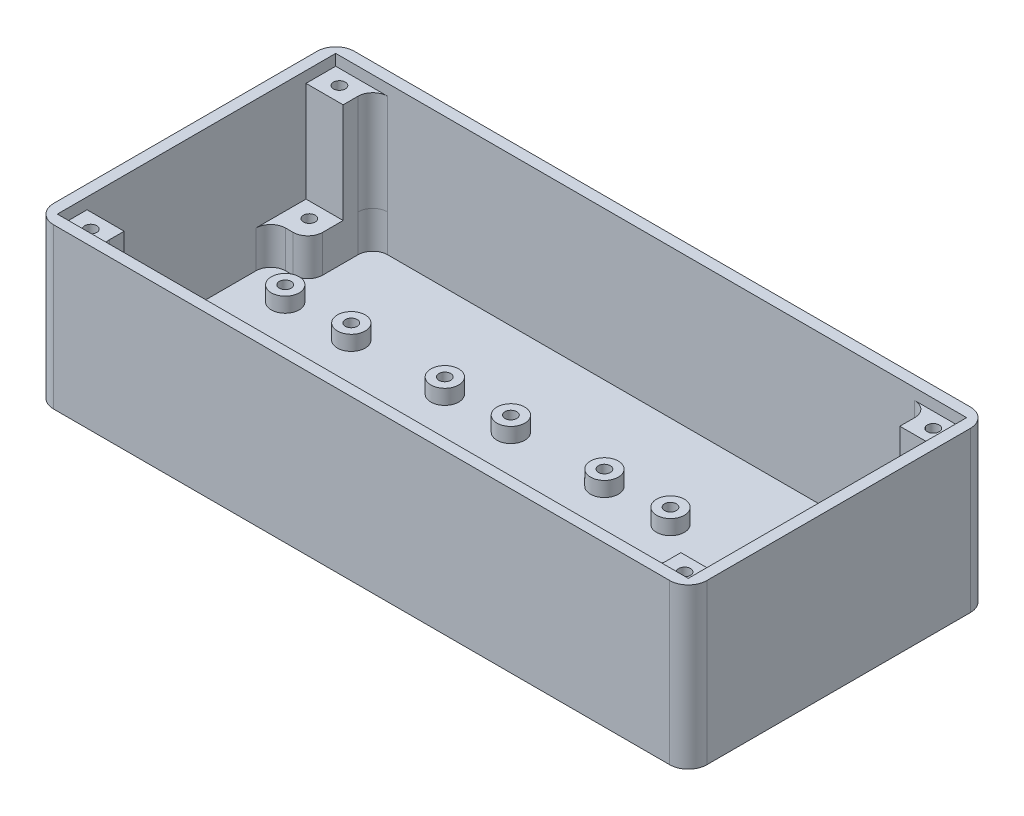
from build123d import *

# Parameters (mm, degrees)
SKETCH1_W           = 170
SKETCH1_H           = 75
BOSS_EXTRUDE1_DEPTH = 40
SHELL1_T            = 3
FILLET1_R           = 5
SKETCH2_W           = 10
SKETCH2_H           = 17.5
SKETCH2_R           = 1.6
BOSS_EXTRUDE2_DEPTH = 10
FILLET2_R           = 4
SKETCH5_W           = 10
SKETCH5_H           = 8
SKETCH5_R           = 1.6
BOSS_EXTRUDE3_DEPTH = 27
FILLET3_R           = 4
MIRROR7_OUTLINE_W   = 10
MIRROR7_OUTLINE_H   = 8
MIRROR7_OUTLINE_R   = 1.6
MIRROR7_DEPTH       = 37
MIRROR7_2_OUTLINE_R = 1.6
MIRROR7_2_DEPTH     = 10
MIRROR9_OUTLINE_W   = 10
MIRROR9_OUTLINE_H   = 8
MIRROR9_OUTLINE_R   = 1.6
MIRROR9_DEPTH       = 37
MIRROR9_2_OUTLINE_R = 1.6
MIRROR9_2_DEPTH     = 10
FILLET5_R           = 4
SKETCH6_R           = 3.75
SKETCH6_R_2         = 1.6
BOSS_EXTRUDE4_DEPTH = 7
LPATTERN1_COUNT     = 4
LPATTERN1_PITCH     = 43


# Read off the part's stored shape, not the designer's step: Mirror7, Mirror9
# Some blends are built 0.0001 mm under size
with BuildPart() as part:
    # Sketch1 → Boss-Extrude1 (new body)
    with BuildSketch(Plane(origin=(0, 0, 0), x_dir=(1, 0, 0), z_dir=(0, 1, 0))):
        Rectangle(SKETCH1_W, SKETCH1_H)
    extrude(amount=BOSS_EXTRUDE1_DEPTH)

    # Shell1
    shell1_openings = [part.faces().sort_by_distance(p)[0] for p in [
        (0, 40, 0),
    ]]
    offset(amount=SHELL1_T, openings=shell1_openings, kind=Kind.INTERSECTION)

    # Fillet1
    # the kernel refuses this fillet: 5 mm, written as the material it takes off along each edge
    with BuildSketch(Plane(origin=(-88, 52.5, 40.5), x_dir=(1, 0, 0), z_dir=(0, -1, 0)), Plane(origin=(88, -15.5, 40.5), x_dir=(-1, 0, 0), z_dir=(0, 1, 0)), Plane(origin=(88, -15.5, -40.5), x_dir=(0, 0, 1), z_dir=(0, 1, 0)), Plane(origin=(-88, -15.5, -40.5), x_dir=(1, 0, 0), z_dir=(0, 1, 0))) as fillet1_piece_1:
        with BuildLine():
            CenterArc((FILLET1_R, -FILLET1_R), FILLET1_R, 90, 90)
            Line((0, -FILLET1_R), (0, 0))
            Line((0, 0), (FILLET1_R, 0))
        make_face()
    extrude(amount=68, mode=Mode.SUBTRACT)

    # Sketch2 → Boss-Extrude2 (add)
    with BuildSketch(Plane(origin=(0, 0, 0), x_dir=(1, 0, 0), z_dir=(0, 1, 0))):
        with Locations((-80, 28.75)):
            Rectangle(SKETCH2_W, SKETCH2_H)
        with Locations(Location((-80, 25.4, 0), (0, 0, 270))):
            Circle(SKETCH2_R, mode=Mode.SUBTRACT)
    extrude(amount=BOSS_EXTRUDE2_DEPTH)

    # Fillet2
    fillet2_edges = [part.edges().sort_by_distance(p)[0] for p in [
        (-85, 5, -20),
        (-75, 5, -20),
        (-75, 5, -37.5),
    ]]
    fillet(fillet2_edges, radius=FILLET2_R)

    # Sketch5 → Boss-Extrude3 (add)
    with BuildSketch(Plane(origin=(0, 10, 0), x_dir=(1, 0, 0), z_dir=(0, 1, 0))):
        with Locations((-80, 33.5)):
            Rectangle(SKETCH5_W, SKETCH5_H)
        with Locations(Location((-80, 33.5, 0), (0, 0, 270))):
            Circle(SKETCH5_R, mode=Mode.SUBTRACT)
    extrude(amount=BOSS_EXTRUDE3_DEPTH)

    # Fillet3
    fillet3_edges = [part.edges().sort_by_distance(p)[0] for p in [
        (-75, 23.5, -37.5),
    ]]
    fillet(fillet3_edges, radius=FILLET3_R)

    # Mirror7 outline → Mirror7 (add)
    with BuildSketch(Plane(origin=(0, 0, 0), x_dir=(1, 0, 0), z_dir=(0, 1, 0))):
        with Locations((-80, -33.5)):
            Rectangle(MIRROR7_OUTLINE_W, MIRROR7_OUTLINE_H)
        with Locations((-80, -33.5)):
            Circle(MIRROR7_OUTLINE_R, mode=Mode.SUBTRACT)
    extrude(amount=MIRROR7_DEPTH)

    # Mirror7 2 outline → Mirror7 2 (add)
    # profile 1 of 2: a face of its own
    with BuildSketch(Plane(origin=(0, 0, 0), x_dir=(1, 0, 0), z_dir=(0, 1, 0))):
        with BuildLine():
            Line((-85, -29.5), (-75, -29.5))
            Line((-75, -29.5), (-75, -24))
            ThreePointArc((-75, -24), (-76.171572875, -21.171572875), (-79, -20))
            Line((-79, -20), (-81, -20))
            ThreePointArc((-81, -20), (-83.828427125, -18.828427125), (-85, -16))
            Line((-85, -16), (-85, -29.5))
        make_face()
        with Locations((-80, -25.4)):
            Circle(MIRROR7_2_OUTLINE_R, mode=Mode.SUBTRACT)
    # profile 2 of 2: a face of its own
    with BuildSketch(Plane(origin=(0, 0, 0), x_dir=(1, 0, 0), z_dir=(0, 1, 0))):
        with Locations((-80, -33.5)):
            Circle(MIRROR7_2_OUTLINE_R)
    extrude(amount=MIRROR7_2_DEPTH)

    # Mirror9 outline → Mirror9 (add)
    # profile 1 of 2: a face of its own
    with BuildSketch(Plane(origin=(0, 0, 0), x_dir=(1, 0, 0), z_dir=(0, 1, 0))):
        with Locations((80, 33.5)):
            Rectangle(MIRROR9_OUTLINE_W, MIRROR9_OUTLINE_H)
        with Locations((80, 33.5)):
            Circle(MIRROR9_OUTLINE_R, mode=Mode.SUBTRACT)
    # profile 2 of 2: a face of its own
    with BuildSketch(Plane(origin=(0, 0, 0), x_dir=(1, 0, 0), z_dir=(0, 1, 0))):
        with Locations((80, -33.5)):
            Rectangle(MIRROR9_OUTLINE_W, MIRROR9_OUTLINE_H)
        with Locations((80, -33.5)):
            Circle(MIRROR9_OUTLINE_R, mode=Mode.SUBTRACT)
    extrude(amount=MIRROR9_DEPTH)

    # Mirror9 2 outline → Mirror9 2 (add)
    # profile 1 of 5: a face of its own
    with BuildSketch(Plane(origin=(0, 0, 0), x_dir=(1, 0, 0), z_dir=(0, 1, 0))):
        with BuildLine():
            ThreePointArc((75, 24), (76.171572875, 21.171572875), (79, 20))
            Line((79, 20), (85, 20))
            Line((85, 20), (85, 29.5))
            Line((85, 29.5), (75, 29.5))
            Line((75, 29.5), (75, 24))
        make_face()
        with Locations((80, 25.4)):
            Circle(MIRROR9_2_OUTLINE_R, mode=Mode.SUBTRACT)
    # profile 2 of 5: a face of its own
    with BuildSketch(Plane(origin=(0, 0, 0), x_dir=(1, 0, 0), z_dir=(0, 1, 0))):
        with BuildLine():
            Line((85, -29.5), (85, -20))
            Line((85, -20), (79, -20))
            ThreePointArc((79, -20), (76.171572875, -21.171572875), (75, -24))
            Line((75, -24), (75, -29.5))
            Line((75, -29.5), (85, -29.5))
        make_face()
        with Locations((80, -25.4)):
            Circle(MIRROR9_2_OUTLINE_R, mode=Mode.SUBTRACT)
    # profile 3 of 5: a face of its own
    with BuildSketch(Plane(origin=(0, 0, 0), x_dir=(1, 0, 0), z_dir=(0, 1, 0))):
        with BuildLine():
            ThreePointArc((71, 37.5), (73.828427125, 36.328427125), (75, 33.5))
            Line((75, 33.5), (75, 37.5))
            Line((75, 37.5), (71, 37.5))
        make_face()
    # profile 4 of 5: a face of its own
    with BuildSketch(Plane(origin=(0, 0, 0), x_dir=(1, 0, 0), z_dir=(0, 1, 0))):
        with Locations((80, -33.5)):
            Circle(MIRROR9_2_OUTLINE_R)
    # profile 5 of 5: a face of its own
    with BuildSketch(Plane(origin=(0, 0, 0), x_dir=(1, 0, 0), z_dir=(0, 1, 0))):
        with Locations((80, 33.5)):
            Circle(MIRROR9_2_OUTLINE_R)
    extrude(amount=MIRROR9_2_DEPTH)

    # Fillet5
    fillet5_edges = [part.edges().sort_by_distance(p)[0] for p in [
        (75, 18.5, 37.5),
        (85, 5, 20),
        (85, 5, -20),
        (75, 23.5, -37.5),
        (-75, 18.5, 37.5),
    ]]
    fillet(fillet5_edges, radius=FILLET5_R - 0.0001)  # a hair under: the kernel refuses the full size

    # Sketch6 → Boss-Extrude4 (add)
    # profile 1 of 4: a face of its own
    with BuildSketch(Plane(origin=(0, -3, 0), x_dir=(1, 0, 0), z_dir=(0, 1, 0))):
        with Locations(Location((-56, 12.7, 0), (0, 0, 90))):
            Circle(SKETCH6_R)
        with Locations(Location((-56, 12.7, 0), (0, 0, 90))):
            Circle(SKETCH6_R_2, mode=Mode.SUBTRACT)
    # profile 2 of 4: a face of its own
    with BuildSketch(Plane(origin=(0, -3, 0), x_dir=(1, 0, 0), z_dir=(0, 1, 0))):
        with Locations(Location((-56, -12.7, 0), (0, 0, 90))):
            Circle(SKETCH6_R)
        with Locations(Location((-56, -12.7, 0), (0, 0, 90))):
            Circle(SKETCH6_R_2, mode=Mode.SUBTRACT)
    # profile 3 of 4: a face of its own
    with BuildSketch(Plane(origin=(0, -3, 0), x_dir=(1, 0, 0), z_dir=(0, 1, 0))):
        with Locations(Location((-73.8, 12.7, 0), (0, 0, 90))):
            Circle(SKETCH6_R)
        with Locations(Location((-73.8, 12.7, 0), (0, 0, 90))):
            Circle(SKETCH6_R_2, mode=Mode.SUBTRACT)
    # profile 4 of 4: a face of its own
    with BuildSketch(Plane(origin=(0, -3, 0), x_dir=(1, 0, 0), z_dir=(0, 1, 0))):
        with Locations(Location((-73.8, -12.7, 0), (0, 0, 90))):
            Circle(SKETCH6_R)
        with Locations(Location((-73.8, -12.7, 0), (0, 0, 90))):
            Circle(SKETCH6_R_2, mode=Mode.SUBTRACT)
    boss_extrude4 = extrude(amount=BOSS_EXTRUDE4_DEPTH)

    # LPattern1: Boss-Extrude4 ×4
    with Locations(*[(i * LPATTERN1_PITCH, 0, 0) for i in range(1, LPATTERN1_COUNT)]):
        add(boss_extrude4)


solid = part.part
